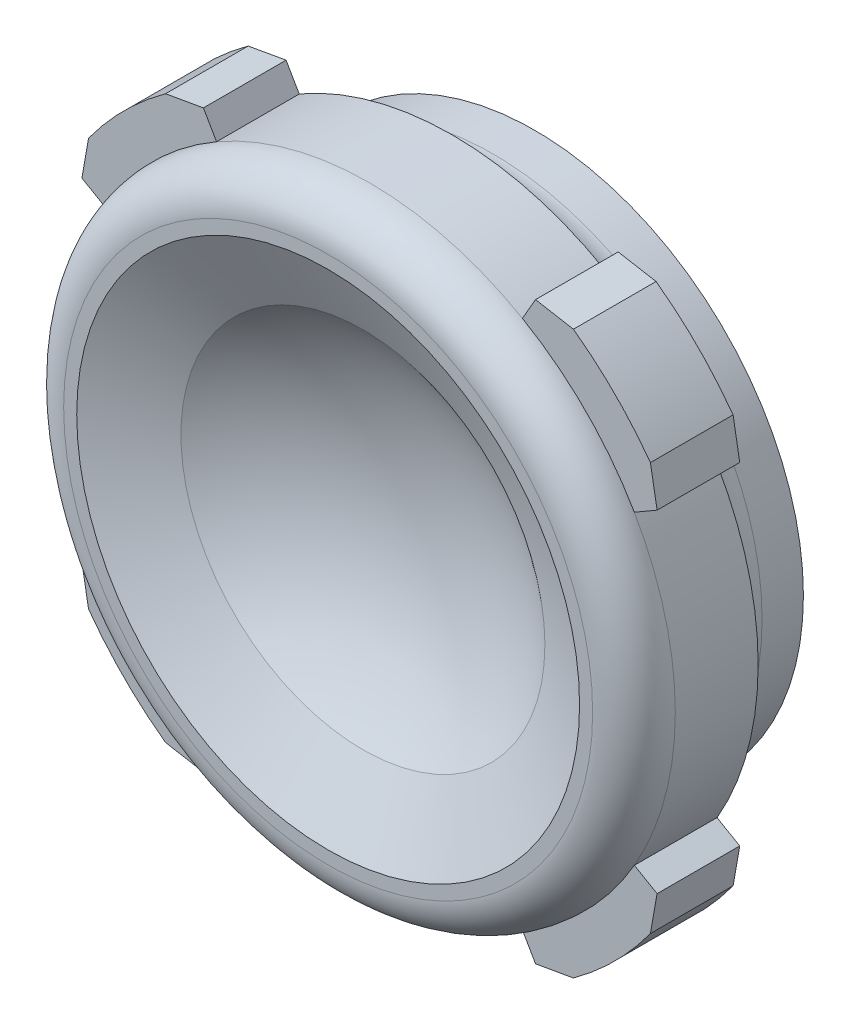
from build123d import *

# Parameters (mm, degrees)
SKETCH_1_R                           = 37
EXTRUDE_1_DEPTH                      = 15
FILLET_2_R                           = 5
EXTRUDE_3_DEPTH                      = 10
CHAMFER_2_SIZE                       = 1.819851171
CHAMFER_3_SIZE                       = 1.819851171
PATTERN_CIRCULAR_4_COUNT             = 4
CHAMFER_2_OF_PATTERN_CIRCULAR_4_SIZE = 1.819851171
CHAMFER_3_OF_PATTERN_CIRCULAR_4_SIZE = 1.819851171
SKETCH_9_R                           = 32.5
SKETCH_9_R_2                         = 31
EXTRUDE_4_DEPTH                      = 10
SKETCH_9_3_R                         = 25
EXTRUDE_5_DEPTH                      = 10
FILLET_3_R                           = 5


with BuildPart() as part:
    # 草圖1 → 填料-伸長1 (new body)
    with BuildSketch(Plane.XY):
        Circle(SKETCH_1_R)
    extrude(amount=EXTRUDE_1_DEPTH)

    # 草圖2 → 除料-旋轉2 (revolve, cut)
    with BuildSketch(Plane.XY.offset(38)):
        with BuildLine():
            Line((-35, 0), (35, 0))
            ThreePointArc((35, 0), (0, -35), (-35, 0))
        make_face()
    revolve(axis=Axis((-35, 0, 38), (1, 0, 0)), mode=Mode.SUBTRACT)

    # 導角1: read off the stored shape, not the designer's step
    # 導角1 outline → 導角1 (revolve, cut)
    with BuildSketch(Plane.XZ):
        Polygon((22.017739237, 15), (22.017739237, 10.79303106), (30.419689063, 15), align=None)
    revolve(axis=Axis((0, 0, 0), (0, 0, 1)), mode=Mode.SUBTRACT)

    # 圓角2
    fillet_2_edges = [part.edges().sort_by_distance(p)[0] for p in [
        (-37, 0, 15),
    ]]
    fillet(fillet_2_edges, radius=FILLET_2_R)

    # 草圖8 → 填料-伸長3 (add)
    with BuildSketch(Plane.XY):
        with BuildLine():
            Line((21, 36.373066959), (18.5, 32.04293994))
            ThreePointArc((18.5, 32.04293994), (26.162950904, 26.162950904), (32.04293994, 18.5))
            Line((32.04293994, 18.5), (36.373066959, 21))
            ThreePointArc((36.373066959, 21), (29.69848481, 29.69848481), (21, 36.373066959))
        make_face()
    extrude_3 = extrude(amount=EXTRUDE_3_DEPTH)

    # 導角2
    # the kernel refuses this chamfer: 5, 1.819851171 mm, written as the material it takes off along each edge
    with BuildSketch(Plane(origin=(21, 36.373066959, -11.408988882), x_dir=(-0.5000000000000003, -0.8660254037844385, 0), z_dir=(0, 0, 1))) as chamfer_2_piece_1:
        with BuildLine():
            Line((CHAMFER_2_SIZE, 0), (0.22826162, 4.372856354))
            ThreePointArc((0.22826162, 4.372856354), (0.06200601, 2.281372415), (0, 0))
            Line((0, 0), (CHAMFER_2_SIZE, 0))
        make_face()
    extrude(amount=32.817977764, mode=Mode.SUBTRACT)

    # 導角3
    # the kernel refuses this chamfer: 5, 1.819851171 mm, written as the material it takes off along each edge
    with BuildSketch(Plane(origin=(36.373066959, 21, -11.408988882), x_dir=(-0.8660254037844387, -0.5000000000000001, 0), z_dir=(0, 0, 1))) as chamfer_3_piece_1:
        with BuildLine():
            Line((CHAMFER_3_SIZE, 0), (0.22826162, -4.372856354))
            ThreePointArc((0.22826162, -4.372856354), (0.06200601, -2.281372415), (0, 0))
            Line((0, 0), (CHAMFER_3_SIZE, 0))
        make_face()
    extrude(amount=32.817977764, mode=Mode.SUBTRACT)

    # 環狀複製排列4: 填料-伸長3 ×4 about axis
    pattern_circular_4_axis = Axis((0, 0, 0), (0, 0, 1))
    for i in range(1, PATTERN_CIRCULAR_4_COUNT):
        add(extrude_3.rotate(pattern_circular_4_axis, i * 360 / PATTERN_CIRCULAR_4_COUNT))

    # 導角2 of 環狀複製排列4
    # the kernel refuses this chamfer: 5, 1.819851171 mm, written as the material it takes off along each edge
    with BuildSketch(Plane(origin=(-36.373066959, 21, -11.408988882), x_dir=(0.5444649568890038, 0.8387835899204604, 0), z_dir=(0, 0, 1)), Plane(origin=(-21, -36.373066959, -11.408988882), x_dir=(-0.8387835899204604, 0.5444649568890038, 0), z_dir=(0, 0, 1)), Plane(origin=(36.373066959, -21, -11.408988882), x_dir=(-0.5444649568890034, -0.8387835899204606, 0), z_dir=(0, 0, 1))) as chamfer_2_of_pattern_circular_4_piece_1:
        with BuildLine():
            Line((4.378809891, 0), (CHAMFER_2_OF_PATTERN_CIRCULAR_4_SIZE * 0.0521286891855, -CHAMFER_2_OF_PATTERN_CIRCULAR_4_SIZE * 0.998640375775))
            Line((CHAMFER_2_OF_PATTERN_CIRCULAR_4_SIZE * 0.0521286891855, -CHAMFER_2_OF_PATTERN_CIRCULAR_4_SIZE * 0.998640375775), (0, 0))
            ThreePointArc((0, 0), (2.281502898, 0.057003248), (4.378809891, 0))
        make_face()
    extrude(amount=32.817977764, mode=Mode.SUBTRACT)

    # 導角3 of 環狀複製排列4
    # the kernel refuses this chamfer: 5, 1.819851171 mm, written as the material it takes off along each edge
    with BuildSketch(Plane(origin=(-21, 36.373066959, -11.408988882), x_dir=(0.5000000000000001, -0.8660254037844387, 0), z_dir=(0, 0, 1))) as chamfer_3_of_pattern_circular_4_piece_1:
        with BuildLine():
            Line((CHAMFER_3_OF_PATTERN_CIRCULAR_4_SIZE, 0), (0.22826162, -4.372856354))
            ThreePointArc((0.22826162, -4.372856354), (0.06200601, -2.281372415), (0, 0))
            Line((0, 0), (CHAMFER_3_OF_PATTERN_CIRCULAR_4_SIZE, 0))
        make_face()
    extrude(amount=32.817977764, mode=Mode.SUBTRACT)
    with BuildSketch(Plane(origin=(-36.373066959, -21, -11.408988882), x_dir=(0.5444649568890013, -0.8387835899204622, 0), z_dir=(0, 0, 1)), Plane(origin=(21, -36.373066959, -11.408988882), x_dir=(0.8387835899204622, 0.5444649568890012, 0), z_dir=(0, 0, 1))) as chamfer_3_of_pattern_circular_4_piece_2:
        with BuildLine():
            Line((4.378809891, 0), (CHAMFER_3_OF_PATTERN_CIRCULAR_4_SIZE * 0.0521286891855, CHAMFER_3_OF_PATTERN_CIRCULAR_4_SIZE * 0.998640375775))
            Line((CHAMFER_3_OF_PATTERN_CIRCULAR_4_SIZE * 0.0521286891855, CHAMFER_3_OF_PATTERN_CIRCULAR_4_SIZE * 0.998640375775), (0, 0))
            ThreePointArc((0, 0), (2.281502898, -0.057003248), (4.378809891, 0))
        make_face()
    extrude(amount=32.817977764, mode=Mode.SUBTRACT)

    # 草圖9 → 填料-伸長4 (add)
    with BuildSketch(Plane(origin=(0, 0, 0), x_dir=(-1, 0, 0), z_dir=(0, 0, -1))):
        with Locations(Location((0, 0, 0), (0, 0, 180))):
            Circle(SKETCH_9_R)
        Circle(SKETCH_9_R_2, mode=Mode.SUBTRACT)
    extrude(amount=EXTRUDE_4_DEPTH)

    # 草圖9<3> → 填料-伸長5 (add)
    with BuildSketch(Plane(origin=(0, 0, 0), x_dir=(-1, 0, 0), z_dir=(0, 0, -1))):
        with Locations(Location((0, 0, 0), (0, 0, 180))):
            Circle(SKETCH_9_3_R)
    extrude(amount=EXTRUDE_5_DEPTH)

    # 圓角3
    # the kernel refuses this fillet: 5 mm, written as the material it adds along each edge
    with BuildSketch(Plane(origin=(0, 0, 0), x_dir=(1, 0, 0), z_dir=(0, 1, 0))) as fillet_3_piece_1_section:
        with BuildLine():
            CenterArc((32.5 + FILLET_3_R, FILLET_3_R), FILLET_3_R, 180, 90)
            Line((32.5, FILLET_3_R), (32.5, 0))
            Line((32.5, 0), (32.5 + FILLET_3_R, 0))
        make_face()
    fillet_3_piece_1 = revolve(axis=Axis((0, 0, 0), (0, 0, -1)), mode=Mode.PRIVATE)
    fillet_3_piece_1 = fillet_3_piece_1 & Plane(origin=(0, 0, 0), x_dir=(1, 0, 0), z_dir=(0, 0, -1)) * Cylinder(37, 150, mode=Mode.PRIVATE)
    add(fillet_3_piece_1)
    with BuildSketch(Plane(origin=(0, 0, 0), x_dir=(1, 0, 0), z_dir=(0, 1, 0))) as fillet_3_piece_2_section:
        with BuildLine():
            CenterArc((32.5 + FILLET_3_R, FILLET_3_R), FILLET_3_R, 180, 90)
            Line((32.5, FILLET_3_R), (32.5, 0))
            Line((32.5, 0), (32.5 + FILLET_3_R, 0))
        make_face()
    fillet_3_piece_2 = revolve(axis=Axis((0, 0, 0), (0, 0, -1)), mode=Mode.PRIVATE)
    fillet_3_piece_2 = split(fillet_3_piece_2, bisect_by=Plane(origin=(0, 0, 0), z_dir=(0.8660254037844387, 0.5000000000000001, 0)), keep=Keep.TOP, mode=Mode.PRIVATE)
    fillet_3_piece_2 = split(fillet_3_piece_2, bisect_by=Plane(origin=(0, 0, 0), z_dir=(-0.4999999999999997, -0.8660254037844389, 0)), keep=Keep.TOP, mode=Mode.PRIVATE)
    add(fillet_3_piece_2)
    with BuildSketch(Plane(origin=(0, 0, 0), x_dir=(1, 0, 0), z_dir=(0, 1, 0))) as fillet_3_piece_3_section:
        with BuildLine():
            CenterArc((32.5 + FILLET_3_R, FILLET_3_R), FILLET_3_R, 180, 90)
            Line((32.5, FILLET_3_R), (32.5, 0))
            Line((32.5, 0), (32.5 + FILLET_3_R, 0))
        make_face()
    fillet_3_piece_3 = revolve(axis=Axis((0, 0, 0), (0, 0, -1)), mode=Mode.PRIVATE)
    fillet_3_piece_3 = split(fillet_3_piece_3, bisect_by=Plane(origin=(0, 0, 0), z_dir=(0.8660254037844388, -0.4999999999999997, 0)), keep=Keep.TOP, mode=Mode.PRIVATE)
    fillet_3_piece_3 = split(fillet_3_piece_3, bisect_by=Plane(origin=(0, 0, 0), z_dir=(-0.5000000000000001, 0.8660254037844386, 0)), keep=Keep.TOP, mode=Mode.PRIVATE)
    add(fillet_3_piece_3)
    with BuildSketch(Plane(origin=(0, 0, 0), x_dir=(1, 0, 0), z_dir=(0, 1, 0))) as fillet_3_piece_4_section:
        with BuildLine():
            CenterArc((32.5 + FILLET_3_R, FILLET_3_R), FILLET_3_R, 180, 90)
            Line((32.5, FILLET_3_R), (32.5, 0))
            Line((32.5, 0), (32.5 + FILLET_3_R, 0))
        make_face()
    fillet_3_piece_4 = revolve(axis=Axis((0, 0, 0), (0, 0, -1)), mode=Mode.PRIVATE)
    fillet_3_piece_4 = split(fillet_3_piece_4, bisect_by=Plane(origin=(0, 0, 0), z_dir=(-0.8660254037844388, 0.4999999999999997, 0)), keep=Keep.TOP, mode=Mode.PRIVATE)
    fillet_3_piece_4 = split(fillet_3_piece_4, bisect_by=Plane(origin=(0, 0, 0), z_dir=(0.5000000000000001, -0.8660254037844386, 0)), keep=Keep.TOP, mode=Mode.PRIVATE)
    add(fillet_3_piece_4)
    with BuildSketch(Plane(origin=(0, 0, 0), x_dir=(1, 0, 0), z_dir=(0, 1, 0))) as fillet_3_piece_5_section:
        with BuildLine():
            CenterArc((32.5 + FILLET_3_R, FILLET_3_R), FILLET_3_R, 180, 90)
            Line((32.5, FILLET_3_R), (32.5, 0))
            Line((32.5, 0), (32.5 + FILLET_3_R, 0))
        make_face()
    fillet_3_piece_5 = revolve(axis=Axis((0, 0, 0), (0, 0, -1)), mode=Mode.PRIVATE)
    fillet_3_piece_5 = split(fillet_3_piece_5, bisect_by=Plane(origin=(0, 0, 0), z_dir=(-0.8660254037844387, -0.5000000000000001, 0)), keep=Keep.TOP, mode=Mode.PRIVATE)
    fillet_3_piece_5 = split(fillet_3_piece_5, bisect_by=Plane(origin=(0, 0, 0), z_dir=(0.4999999999999997, 0.8660254037844389, 0)), keep=Keep.TOP, mode=Mode.PRIVATE)
    add(fillet_3_piece_5)


solid = part.part
